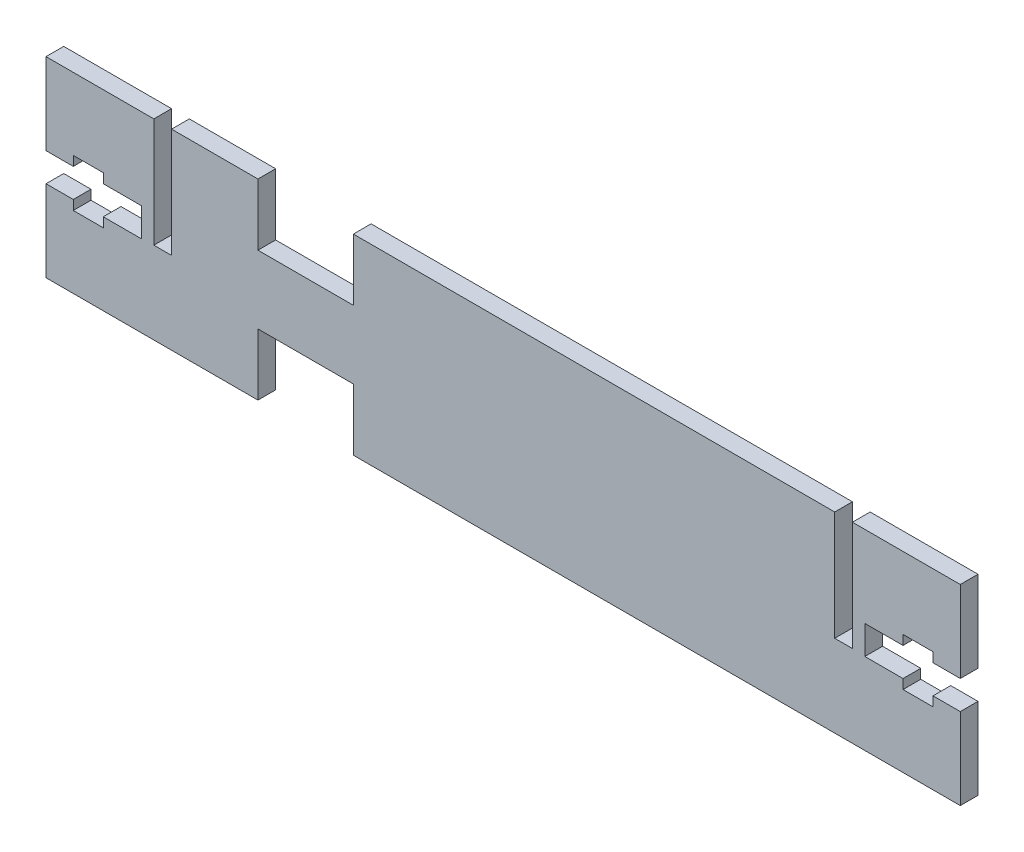
from build123d import *

# Parameters (mm, degrees)
BOSS_EXTRUDE1_DEPTH = 1.651
CUT_EXTRUDE1_DEPTH  = 88.093386438
SKETCH3_W           = 17.78
SKETCH3_H           = 11.4935
CUT_EXTRUDE2_DEPTH  = 12.192


with BuildPart() as part:
    # Sketch1 → Boss-Extrude1 (new, symmetric)
    with BuildSketch(Plane.XY):
        Polygon((85.181948, -17.8435), (85.181948, 17.8435), (65.084948, 17.8435), (65.084948, -2.54), (61.782948, -2.54), (61.782948, 17.8435), (-61.782948, 17.8435), (-61.782948, -2.54), (-65.084948, -2.54), (-65.084948, 17.8435), (-85.181948, 17.8435), (-85.181948, -17.8435), align=None)
    extrude(amount=BOSS_EXTRUDE1_DEPTH, both=True)

    # Sketch2 → Cut-Extrude1 (cut, through all)
    with BuildSketch(Plane.XY.offset(1.651)):
        Polygon((85.181948, 2.667), (80.101948, 2.667), (80.101948, 4.445), (74.513948, 4.445), (74.513948, 2.667), (67.401948, 2.667), (67.401948, -2.667), (74.513948, -2.667), (74.513948, -4.445), (80.101948, -4.445), (80.101948, -2.667), (85.181948, -2.667), align=None)
        Polygon((-85.181948, -2.667), (-80.101948, -2.667), (-80.101948, -4.445), (-74.513948, -4.445), (-74.513948, -2.667), (-67.401948, -2.667), (-67.401948, 2.667), (-74.513948, 2.667), (-74.513948, 4.445), (-80.101948, 4.445), (-80.101948, 2.667), (-85.181948, 2.667), align=None)
    extrude(amount=-CUT_EXTRUDE1_DEPTH, mode=Mode.SUBTRACT)

    # Sketch3 → Cut-Extrude2 (cut)
    with BuildSketch(Plane.XY.offset(1.651)):
        with Locations((-36.801552, 12.09675)):
            Rectangle(SKETCH3_W, SKETCH3_H)
        with Locations((-36.801552, -12.09675)):
            Rectangle(SKETCH3_W, SKETCH3_H)
    extrude(amount=-CUT_EXTRUDE2_DEPTH, mode=Mode.SUBTRACT)


solid = part.part
